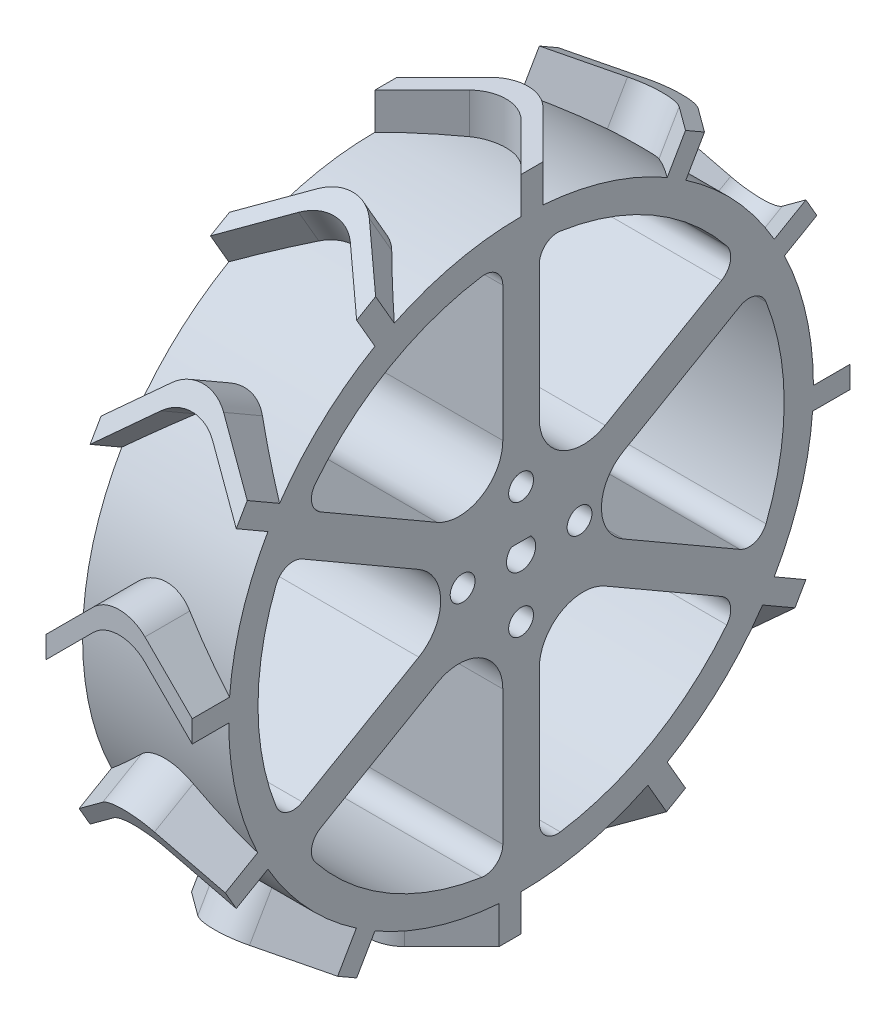
from build123d import *

# Parameters (mm, degrees)
SKETCH2_R                = 40
BOSS_EXTRUDE1_DEPTH      = 20
BOSS_EXTRUDE2_DEPTH      = 45
CIRPATTERN2_COUNT        = 12
CUT_EXTRUDE3_REACH       = 68.708
FILLET1_R                = 6
CIRPATTERN3_COUNT        = 6
FILLET1_OF_CIRPATTERN3_R = 6
CUT_EXTRUDE4_REACH       = 68.708
SKETCH6_R                = 1.7
SKETCH6_R_2              = 1.6999999999999995
SKETCH6_R_3              = 1.7000000000000008
SKETCH6_R_4              = 1.7000000000000004
CUT_EXTRUDE6_DEPTH       = 67.70832048552884
CUT_EXTRUDE6_DEPTH_BACK  = 67.70832048552884


with BuildPart() as part:
    # Sketch2 → Boss-Extrude1 (new body)
    with BuildSketch(Plane(origin=(0, 0, 0), x_dir=(0, 0, -1), z_dir=(1, 0, 0))):
        Circle(SKETCH2_R)
    extrude(amount=BOSS_EXTRUDE1_DEPTH)

    # Sketch4 → Boss-Extrude2 (add)
    with BuildSketch(Plane(origin=(0, 0, 0), x_dir=(1, 0, 0), z_dir=(0, 1, 0))):
        with BuildLine():
            Line((0, 0), (6.464466094067264, 6.464466094067263))
            ThreePointArc((6.464466094067264, 6.464466094067263), (10, 7.9289321881345245), (13.535533905932738, 6.464466094067263))
            Line((13.535533905932738, 6.464466094067263), (20, 0))
            Line((20, 0), (20, 3))
            Line((20, 3), (13.53553390593274, 9.464466094067264))
            ThreePointArc((13.53553390593274, 9.464466094067264), (10, 10.928932188134528), (6.464466094067261, 9.464466094067264))
            Line((6.464466094067261, 9.464466094067264), (0, 3))
            Line((0, 3), (0, 0))
        make_face()
    boss_extrude2 = extrude(amount=BOSS_EXTRUDE2_DEPTH)

    # CirPattern2: Boss-Extrude2 ×12 about axis
    cirpattern2_axis = Axis((20, 0, 0), (-1, 0, 0))
    for i in range(1, CIRPATTERN2_COUNT):
        add(boss_extrude2.rotate(cirpattern2_axis, i * 360 / CIRPATTERN2_COUNT))

    # Sketch5 → Cut-Extrude3 (cut, up to next)
    with BuildSketch(Plane.ZY, mode=Mode.PRIVATE) as cut_extrude3_sk1:
        with BuildLine():
            Line((2.499999999999992, 33.12476415010377), (2.4999999999999987, 4.330127018922181))
            Line((2.4999999999999987, 4.330127018922181), (27.436887248357948, 18.727445584512928))
            ThreePointArc((27.436887248357948, 18.727445584512928), (28.6433531155643, 20.427992739848364), (28.141132565399595, 22.451651563673586))
            ThreePointArc((28.141132565399595, 22.451651563673586), (18.000000000000025, 31.176914536239778), (5.3731343283582, 35.59676147473838))
            ThreePointArc((5.3731343283582, 35.59676147473838), (3.3694841032506733, 35.019867817571004), (2.499999999999992, 33.12476415010377))
        make_face()
    cut_extrude3_tool1 = extrude(cut_extrude3_sk1.sketch, amount=-CUT_EXTRUDE3_REACH, mode=Mode.PRIVATE) & part.part
    cut_extrude3 = cut_extrude3_tool1.solids().sort_by_distance((0, 21.473973, 12.398004))[0]
    add(cut_extrude3, mode=Mode.SUBTRACT)

    # Fillet1
    fillet1_edges = [part.edges().sort_by_distance(p)[0] for p in [
        (10, 4.330127018922181, 2.4999999999999987),
    ]]
    fillet(fillet1_edges, radius=FILLET1_R)

    # CirPattern3: Cut-Extrude3 ×6 about axis
    cirpattern3_axis = Axis((0, 0, 0), (1, 0, 0))
    for i in range(1, CIRPATTERN3_COUNT):
        add(cut_extrude3.rotate(cirpattern3_axis, i * 360 / CIRPATTERN3_COUNT), mode=Mode.SUBTRACT)

    # Fillet1 of CirPattern3
    fillet1_of_cirpattern3_edges = [part.edges().sort_by_distance(p)[0] for p in [
        (10, -4.44e-15, 4.999999999999989),
        (10, -4.330127018922186, 2.499999999999991),
        (10, -4.330127018922181, -2.4999999999999982),
        (10, 2.22e-15, -4.999999999999989),
        (10, 4.3301270189221865, -2.49999999999999),
    ]]
    fillet(fillet1_of_cirpattern3_edges, radius=FILLET1_OF_CIRPATTERN3_R)

    # Sketch6 → Cut-Extrude4 (cut, up to next)
    with BuildSketch(Plane.ZY, mode=Mode.PRIVATE) as cut_extrude4_sk1:
        with Locations((0, 8)):
            Circle(SKETCH6_R)
    cut_extrude4_tool1 = extrude(cut_extrude4_sk1.sketch, amount=-CUT_EXTRUDE4_REACH, mode=Mode.PRIVATE) & part.part
    # Sketch6 → Cut-Extrude4 (cut, up to next)
    with BuildSketch(Plane.ZY, mode=Mode.PRIVATE) as cut_extrude4_sk2:
        with Locations((8, 4.3e-16)):
            Circle(SKETCH6_R_2)
    cut_extrude4_tool2 = extrude(cut_extrude4_sk2.sketch, amount=-CUT_EXTRUDE4_REACH, mode=Mode.PRIVATE) & part.part
    # Sketch6 → Cut-Extrude4 (cut, up to next)
    with BuildSketch(Plane.ZY, mode=Mode.PRIVATE) as cut_extrude4_sk3:
        with Locations((9.8e-16, -8)):
            Circle(SKETCH6_R_3)
    cut_extrude4_tool3 = extrude(cut_extrude4_sk3.sketch, amount=-CUT_EXTRUDE4_REACH, mode=Mode.PRIVATE) & part.part
    # Sketch6 → Cut-Extrude4 (cut, up to next)
    with BuildSketch(Plane.ZY, mode=Mode.PRIVATE) as cut_extrude4_sk4:
        with Locations((-8, 6.5e-16)):
            Circle(SKETCH6_R_4)
    cut_extrude4_tool4 = extrude(cut_extrude4_sk4.sketch, amount=-CUT_EXTRUDE4_REACH, mode=Mode.PRIVATE) & part.part
    add(cut_extrude4_tool1.solids().sort_by_distance((0, 8, 0))[0], mode=Mode.SUBTRACT)
    add(cut_extrude4_tool2.solids().sort_by_distance((0, 0, 8))[0], mode=Mode.SUBTRACT)
    add(cut_extrude4_tool3.solids().sort_by_distance((0, -8, 0))[0], mode=Mode.SUBTRACT)
    add(cut_extrude4_tool4.solids().sort_by_distance((0, 0, -8))[0], mode=Mode.SUBTRACT)

    # Sketch8 → Cut-Extrude6 (cut, two sides: drawn at the far end of the back side and taken through both)
    with BuildSketch(Plane(origin=(0, 0, 0), x_dir=(0, 0, -1), z_dir=(1, 0, 0)).offset(-CUT_EXTRUDE6_DEPTH_BACK)):
        with BuildLine():
            Line((1.322875655532295, 1.5000000000000002), (-1.322875655532295, 1.5000000000000002))
            ThreePointArc((-1.322875655532295, 1.5000000000000002), (5.7e-16, -2), (1.322875655532295, 1.5000000000000002))
        make_face()
    extrude(amount=CUT_EXTRUDE6_DEPTH + CUT_EXTRUDE6_DEPTH_BACK, mode=Mode.SUBTRACT)


solid = part.part
